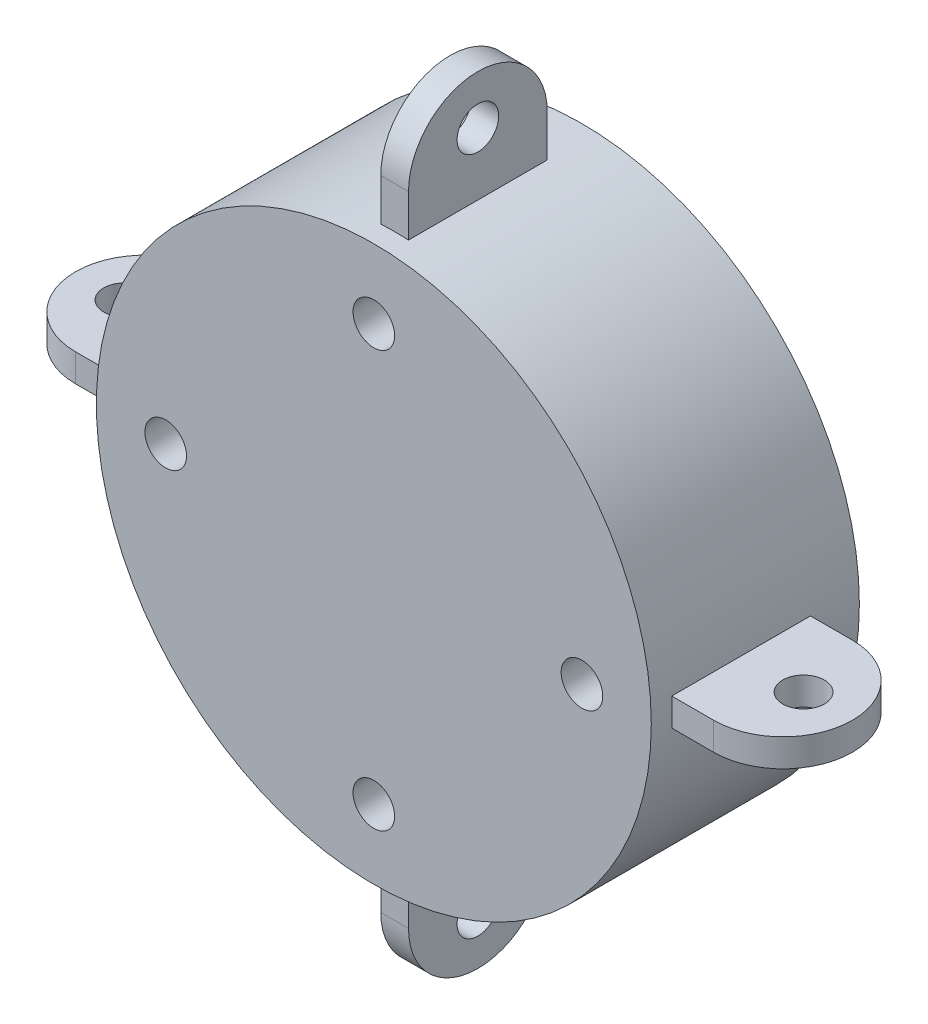
from build123d import *

# Parameters (mm, degrees)
SKETCH_1_R               = 40
EXTRUDE_1_DEPTH          = 30
SKETCH_2_R               = 3
CUT_EXTRUDE_1_DEPTH      = 65.031242374
EXTRUDE_2_DEPTH          = 2
SKETCH_4_R               = 3
CUT_EXTRUDE_2_DEPTH      = 77.157731059
PATTERN_CIRCULAR_2_COUNT = 4


with BuildPart() as part:
    # 草图1 → 凸台-拉伸1 (new body)
    with BuildSketch(Plane.XY):
        Circle(SKETCH_1_R)
    extrude(amount=EXTRUDE_1_DEPTH)

    # 草图2 → 切除-拉伸1 (cut, through all)
    with BuildSketch(Plane.XY.offset(30)):
        with Locations((30, 0)):
            Circle(SKETCH_2_R)
        with Locations((0, 30)):
            Circle(SKETCH_2_R)
        with Locations((-30, 0)):
            Circle(SKETCH_2_R)
        with Locations((0, -30)):
            Circle(SKETCH_2_R)
    extrude(amount=-CUT_EXTRUDE_1_DEPTH, mode=Mode.SUBTRACT)

    # 草图3 → 凸台-拉伸2 (add, symmetric)
    with BuildSketch(Plane(origin=(0, 0, 0), x_dir=(0, 0, -1), z_dir=(1, 0, 0))):
        with BuildLine():
            Line((-7, 38), (-27, 38))
            Line((-27, 38), (-27, 46))
            ThreePointArc((-27, 46), (-17, 56), (-7, 46))
            Line((-7, 46), (-7, 38))
        make_face()
    extrude_2 = extrude(amount=EXTRUDE_2_DEPTH, both=True)

    # 草图4 → 切除-拉伸2 (cut, through all)
    with BuildSketch(Plane(origin=(2, 0, 0), x_dir=(0, 0, -1), z_dir=(1, 0, 0))):
        with Locations((-17, 48.949968711)):
            Circle(SKETCH_4_R)
    cut_extrude_2 = extrude(amount=-CUT_EXTRUDE_2_DEPTH, mode=Mode.SUBTRACT)

    # 阵列(圆周)2: 凸台-拉伸2, 切除-拉伸2 ×4 about axis
    pattern_circular_2_axis = Axis((0, 0, 30), (0, 0, -1))
    add([extrude_2.rotate(pattern_circular_2_axis, i * 360 / PATTERN_CIRCULAR_2_COUNT) for i in range(1, PATTERN_CIRCULAR_2_COUNT)])
    add([cut_extrude_2.rotate(pattern_circular_2_axis, i * 360 / PATTERN_CIRCULAR_2_COUNT) for i in range(1, PATTERN_CIRCULAR_2_COUNT)], mode=Mode.SUBTRACT)


solid = part.part
